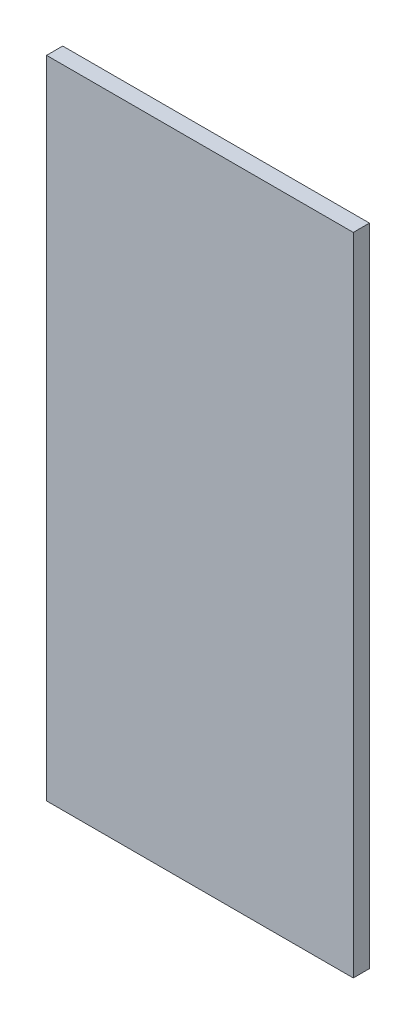
from build123d import *

# Parameters (mm, degrees)
SKETCH_1_W      = 19
SKETCH_1_H      = 40
EXTRUDE_1_DEPTH = 1


with BuildPart() as part:
    # Эскиз1 → Бобышка-Вытянуть1 (new body)
    with BuildSketch(Plane.XY):
        with Locations((9.5, 20)):
            Rectangle(SKETCH_1_W, SKETCH_1_H)
    extrude(amount=EXTRUDE_1_DEPTH)


solid = part.part
